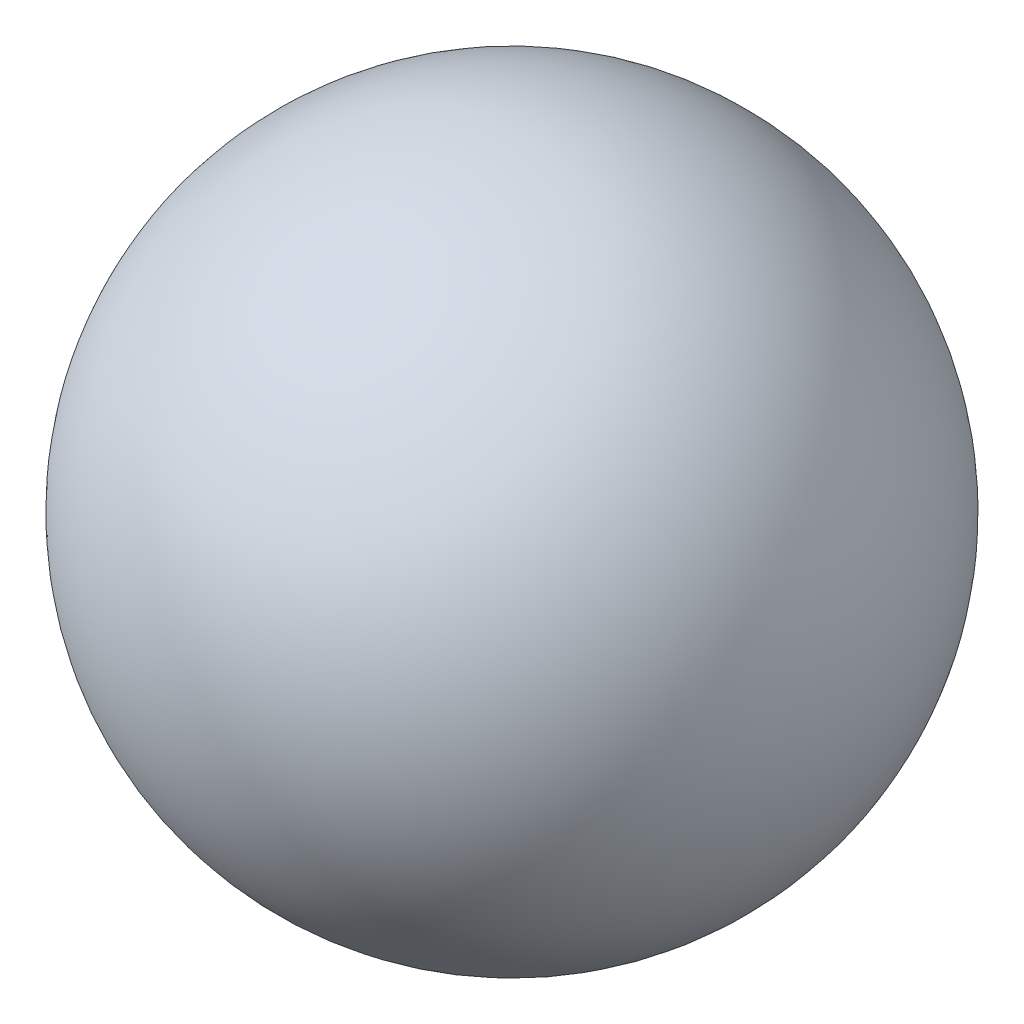
from build123d import *


with BuildPart() as part:
    # Sketch1 → Revolve1 (revolve)
    with BuildSketch(Plane.XY):
        with BuildLine():
            ThreePointArc((7.95, 0), (0, 7.95), (-7.95, 0))
            Line((-7.95, 0), (7.95, 0))
        make_face()
    revolve(axis=Axis((-7.95, 0, 0), (1, 0, 0)))


solid = part.part
